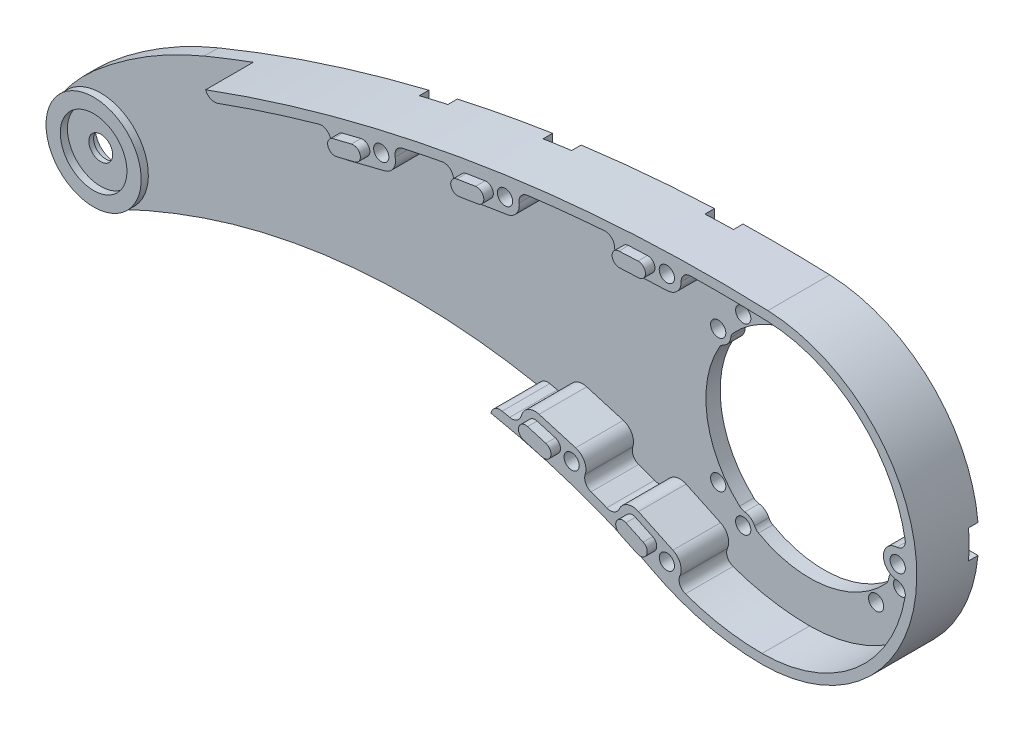
from build123d import *
from build123d.topology import SkipClean

# Parameters (mm, degrees)
SKETCH_1_R          = 1.6
EXTRUDE_1_DEPTH     = 3
EXTRUDE_START       = 10
SKETCH_2_R          = 1.6
EXTRUDE_2_DEPTH     = 10
EXTRUDE_3_DEPTH     = 2
CUT_EXTRUDE_1_REACH = 164.764
SKETCH_5_R          = 1.6
CUT_EXTRUDE_4_REACH = 164.687
SKETCH_10_R         = 2.5
SKETCH_11_R         = 4.15
CUT_EXTRUDE_5_DEPTH = 2
CUT_EXTRUDE_START   = -2
SKETCH_13_R         = 1.6
CUT_EXTRUDE_6_DEPTH = 2
EXTRUDE_START_2     = 1.5
SKETCH_14_R         = 10
SKETCH_14_R_2       = 7
EXTRUDE_4_DEPTH     = 1.5
SKETCH_15_W         = 203.491785531
SKETCH_15_H         = 102.144896266
CUT_EXTRUDE_7_DEPTH = 15


with BuildPart() as part:
    # 草图1 → 凸台-拉伸1 (new body)
    with BuildSketch(Plane.XY):
        with BuildLine():
            ThreePointArc((-23.6380873, -26.566491362), (-12.185705724, -30.993964901), (0, -32.5))
            ThreePointArc((0, -32.5), (32.494299771, -0.608672659), (1.217131806, 32.477201083))
            ThreePointArc((1.217131806, 32.477201083), (-64.206902417, 27.922113621), (-127.172269011, 9.580475598))
            ThreePointArc((-127.172269011, 9.580475598), (-139.222290641, 3.45440527), (-150.14384136, -4.511239012))
            ThreePointArc((-150.14384136, -4.511239012), (-153.910924638, -8.201852374), (-157.1671235, -12.350190882))
            ThreePointArc((-157.1671235, -12.350190882), (-156.816374649, -24.130693578), (-145.491863518, -27.395462511))
            ThreePointArc((-145.491863518, -27.395462511), (-145.026167645, -27.212412967), (-144.570211335, -27.006297405))
            ThreePointArc((-144.570211335, -27.006297405), (-136.08176084, -23.223756861), (-127.379272112, -19.963680984))
            ThreePointArc((-127.379272112, -19.963680984), (-77.471346593, -12.811545944), (-28.370763381, -24.26086005))
            ThreePointArc((-28.370763381, -24.26086005), (-25.98221149, -25.368078233), (-23.6380873, -26.566491362))
        make_face()
        with BuildLine():
            ThreePointArc((13.62552251, 16.585334135), (14.214206094, 16.415884227), (14.723986814, 16.076200182))
            ThreePointArc((14.723986814, 16.076200182), (21.531605825, 3.410271338), (18.971162667, -10.73941279))
            ThreePointArc((18.971162667, -10.73941279), (18.591300533, -11.22000242), (18.083792076, -11.563072091))
            ThreePointArc((18.083792076, -11.563072091), (17.070258581, -12.402268823), (16.585334135, -13.62552251))
            ThreePointArc((16.585334135, -13.62552251), (16.415884227, -14.214206094), (16.076200182, -14.723986814))
            ThreePointArc((16.076200182, -14.723986814), (3.410271338, -21.531605825), (-10.73941279, -18.971162667))
            ThreePointArc((-10.73941279, -18.971162667), (-11.22000242, -18.591300533), (-11.563072091, -18.083792076))
            ThreePointArc((-11.563072091, -18.083792076), (-12.402268823, -17.070258581), (-13.62552251, -16.585334135))
            ThreePointArc((-13.62552251, -16.585334135), (-14.214206094, -16.415884227), (-14.723986814, -16.076200182))
            ThreePointArc((-14.723986814, -16.076200182), (-21.531605825, -3.410271338), (-18.971162667, 10.73941279))
            ThreePointArc((-18.971162667, 10.73941279), (-18.591300533, 11.22000242), (-18.083792076, 11.563072091))
            ThreePointArc((-18.083792076, 11.563072091), (-17.070258581, 12.402268823), (-16.585334135, 13.62552251))
            ThreePointArc((-16.585334135, 13.62552251), (-16.415884227, 14.214206094), (-16.076200182, 14.723986814))
            ThreePointArc((-16.076200182, 14.723986814), (-3.410271338, 21.531605825), (10.73941279, 18.971162667))
            ThreePointArc((10.73941279, 18.971162667), (11.22000242, 18.591300533), (11.563072091, 18.083792076))
            ThreePointArc((11.563072091, 18.083792076), (12.402268823, 17.070258581), (13.62552251, 16.585334135))
        make_face(mode=Mode.SUBTRACT)
        with Locations((-13.959899742, -19.214153616)):
            Circle(SKETCH_1_R, mode=Mode.SUBTRACT)
        with Locations((13.959899742, -19.214153616)):
            Circle(SKETCH_1_R, mode=Mode.SUBTRACT)
        with Locations((-19.214153616, -13.959899742)):
            Circle(SKETCH_1_R, mode=Mode.SUBTRACT)
        with Locations((19.214153616, -13.959899742)):
            Circle(SKETCH_1_R, mode=Mode.SUBTRACT)
        with Locations((-19.214153616, 13.959899742)):
            Circle(SKETCH_1_R, mode=Mode.SUBTRACT)
        with Locations((19.214153616, 13.959899742)):
            Circle(SKETCH_1_R, mode=Mode.SUBTRACT)
        with Locations((-13.959899742, 19.214153616)):
            Circle(SKETCH_1_R, mode=Mode.SUBTRACT)
        with Locations((13.959899742, 19.214153616)):
            Circle(SKETCH_1_R, mode=Mode.SUBTRACT)
    extrude(amount=EXTRUDE_1_DEPTH)

    # 草图2 → 凸台-拉伸2 (add)
    with BuildSketch(Plane(origin=(0, 0, 0), x_dir=(-1, 0, 0), z_dir=(0, 0, -1)).offset(EXTRUDE_START)):
        with BuildLine():
            ThreePointArc((17.001102074, 28.618241459), (17.803337861, 26.493729725), (19.86429336, 25.540002931))
            Line((19.86429336, 25.540002931), (27.856104149, 25.178118556))
            ThreePointArc((27.856104149, 25.178118556), (29.994821549, 25.941676183), (30.985784325, 27.98498848))
            ThreePointArc((30.985784325, 27.98498848), (31.663067744, 29.355553639), (33.113908291, 29.837449265))
            ThreePointArc((33.113908291, 29.837449265), (41.227314196, 29.119699609), (49.318671562, 28.185646114))
            ThreePointArc((49.318671562, 28.185646114), (50.642440563, 27.420925697), (51.029255455, 25.941893607))
            ThreePointArc((51.029255455, 25.941893607), (51.587558118, 23.740659748), (53.528225459, 22.561277437))
            Line((53.528225459, 22.561277437), (61.428685658, 21.303211995))
            ThreePointArc((61.428685658, 21.303211995), (63.63968675, 21.821484643), (64.854085448, 23.740434399))
            ThreePointArc((64.854085448, 23.740434399), (65.681160173, 25.026167296), (67.176979656, 25.341897814))
            ThreePointArc((67.176979656, 25.341897814), (71.378861197, 24.513870134), (75.568707204, 23.626949189))
            ThreePointArc((75.568707204, 23.626949189), (76.820720374, 22.749666619), (77.077039123, 21.242529471))
            ThreePointArc((77.077039123, 21.242529471), (77.441191522, 19.000984157), (79.271578812, 17.656806068))
            Line((79.271578812, 17.656806068), (87.032175615, 15.714349565))
            ThreePointArc((87.032175615, 15.714349565), (89.279958958, 16.037772516), (90.657125441, 17.843470399))
            ThreePointArc((90.657125441, 17.843470399), (91.593206584, 19.052153062), (93.11086617, 19.236193992))
            ThreePointArc((93.11086617, 19.236193992), (103.776807204, 16.016684998), (114.31810295, 12.409938501))
            ThreePointArc((114.31810295, 12.409938501), (115.844352177, 12.477074745), (116.877933734, 13.602087253))
            ThreePointArc((116.877933734, 13.602087253), (58.758007498, 28.843357745), (-1.217131806, 32.477201083))
            ThreePointArc((-1.217131806, 32.477201083), (-32.494299771, -0.608672659), (0, -32.5))
            ThreePointArc((0, -32.5), (12.185705724, -30.993964901), (23.6380873, -26.566491362))
            ThreePointArc((23.6380873, -26.566491362), (25.98221149, -25.368078233), (28.370763381, -24.26086005))
            ThreePointArc((28.370763381, -24.26086005), (42.41745626, -18.97671256), (56.959270146, -15.266261857))
            ThreePointArc((56.959270146, -15.266261857), (56.095337342, -13.994443781), (54.584087249, -13.71155818))
            ThreePointArc((54.584087249, -13.71155818), (53.795279647, -13.881664917), (53.007476337, -14.056363738))
            ThreePointArc((53.007476337, -14.056363738), (51.49343256, -13.803829953), (50.585765393, -12.565992248))
            ThreePointArc((50.585765393, -12.565992248), (49.16571342, -10.693278587), (46.831558377, -10.418825857))
            Line((46.831558377, -10.418825857), (39.155257944, -12.671471339))
            ThreePointArc((39.155257944, -12.671471339), (37.339549641, -14.163720453), (37.156649606, -16.506827715))
            ThreePointArc((37.156649606, -16.506827715), (37.061812001, -18.038855032), (35.924321082, -19.069493805))
            ThreePointArc((35.924321082, -19.069493805), (34.270222566, -19.684778141), (32.624096936, -20.321085557))
            ThreePointArc((32.624096936, -20.321085557), (31.089233, -20.303922581), (30.002334443, -19.220062167))
            ThreePointArc((30.002334443, -19.220062167), (28.311680005, -17.587490076), (25.963057786, -17.674540277))
            Line((25.963057786, -17.674540277), (18.723451368, -21.078669963))
            ThreePointArc((18.723451368, -21.078669963), (17.187310183, -22.750078076), (17.261694817, -25.018954835))
            ThreePointArc((17.261694817, -25.018954835), (17.275070203, -26.622295223), (16.106540278, -27.720210117))
            ThreePointArc((16.106540278, -27.720210117), (8.172329404, -29.799953184), (0, -30.5))
            ThreePointArc((0, -30.5), (-19.662506126, -23.315999932), (-30.062360099, -5.148252645))
            ThreePointArc((-30.062360099, -5.148252645), (-29.685338806, -3.685938076), (-28.342105263, -2.995841994))
            ThreePointArc((-28.342105263, -2.995841994), (-25.5, 0), (-28.342105263, 2.995841994))
            ThreePointArc((-28.342105263, 2.995841994), (-29.685338806, 3.685938076), (-30.062360099, 5.148252645))
            ThreePointArc((-30.062360099, 5.148252645), (-20.095728615, 22.943663427), (-1.142231387, 30.478604093))
            ThreePointArc((-1.142231387, 30.478604093), (6.952265997, 30.674453283), (15.049110071, 30.655457646))
            ThreePointArc((15.049110071, 30.655457646), (16.450460044, 30.044409415), (17.001102074, 28.618241459))
        make_face()
        with Locations((20, -23.793522369)):
            Circle(SKETCH_2_R, mode=Mode.SUBTRACT)
        with Locations((-28.5, 0)):
            Circle(SKETCH_2_R, mode=Mode.SUBTRACT)
        with Locations((40, -15.550084001)):
            Circle(SKETCH_2_R, mode=Mode.SUBTRACT)
        with Locations((20, 28.536931977)):
            Circle(SKETCH_2_R, mode=Mode.SUBTRACT)
        with Locations((54, 25.523950011)):
            Circle(SKETCH_2_R, mode=Mode.SUBTRACT)
        with Locations((80, 20.567029869)):
            Circle(SKETCH_2_R, mode=Mode.SUBTRACT)
    extrude(amount=-EXTRUDE_2_DEPTH)

    # 草图4 → 凸台-拉伸3 (add)
    with BuildSketch(Plane(origin=(0, 0, -10), x_dir=(-1, 0, 0), z_dir=(0, 0, -1))):
        with BuildLine():
            Line((27.877880734, -21.746818887), (24.258077525, -23.44888373))
            ThreePointArc((24.258077525, -23.44888373), (22.262377006, -22.729731843), (22.981528893, -20.734031323))
            Line((22.981528893, -20.734031323), (26.601332102, -19.031966481))
            ThreePointArc((26.601332102, -19.031966481), (28.597032621, -19.751118368), (27.877880734, -21.746818887))
        make_face()
        with BuildLine():
            Line((27.92395747, 26.67658308), (23.928052075, 26.857525267))
            ThreePointArc((23.928052075, 26.857525267), (22.497440872, 28.42384311), (24.063758715, 29.854454313))
            Line((24.063758715, 29.854454313), (28.05966411, 29.673512126))
            ThreePointArc((28.05966411, 29.673512126), (29.490275313, 28.107194282), (27.92395747, 26.67658308))
        make_face()
        with BuildLine():
            Line((87.396386209, 17.169461466), (83.516087807, 18.140689717))
            ThreePointArc((83.516087807, 18.140689717), (82.425186501, 19.960012212), (84.244508996, 21.050913518))
            Line((84.244508996, 21.050913518), (88.124807397, 20.079685267))
            ThreePointArc((88.124807397, 20.079685267), (89.215708703, 18.260362772), (87.396386209, 17.169461466))
        make_face()
        with BuildLine():
            Line((48.098671461, -14.73674485), (44.260521244, -15.863067591))
            ThreePointArc((44.260521244, -15.863067591), (42.398843885, -14.846132288), (43.415779189, -12.984454929))
            Line((43.415779189, -12.984454929), (47.253929405, -11.858132188))
            ThreePointArc((47.253929405, -11.858132188), (49.115606764, -12.875067491), (48.098671461, -14.73674485))
        make_face()
        with BuildLine():
            Line((61.664572928, 22.784548282), (57.714342829, 23.413581003))
            ThreePointArc((57.714342829, 23.413581003), (56.468893812, 25.130804561), (58.186117369, 26.376253578))
            Line((58.186117369, 26.376253578), (62.136347469, 25.747220857))
            ThreePointArc((62.136347469, 25.747220857), (63.381796485, 24.029997299), (61.664572928, 22.784548282))
        make_face()
    extrude(amount=EXTRUDE_3_DEPTH)

    # 草图5 → 切除-拉伸1 (cut, up to next)
    with BuildSketch(Plane(origin=(0, 0, -10), x_dir=(-1, 0, 0), z_dir=(0, 0, -1)), mode=Mode.PRIVATE) as cut_extrude_1_sk1:
        with Locations((-28.5, 0)):
            Circle(SKETCH_5_R)
    cut_extrude_1_tool1 = extrude(cut_extrude_1_sk1.sketch, amount=-CUT_EXTRUDE_1_REACH, mode=Mode.PRIVATE) & part.part
    # 草图5 → 切除-拉伸1 (cut, up to next)
    with BuildSketch(Plane(origin=(0, 0, -10), x_dir=(-1, 0, 0), z_dir=(0, 0, -1)), mode=Mode.PRIVATE) as cut_extrude_1_sk2:
        with Locations((54, 25.523950011)):
            Circle(SKETCH_5_R)
    cut_extrude_1_tool2 = extrude(cut_extrude_1_sk2.sketch, amount=-CUT_EXTRUDE_1_REACH, mode=Mode.PRIVATE) & part.part
    # 草图5 → 切除-拉伸1 (cut, up to next)
    with BuildSketch(Plane(origin=(0, 0, -10), x_dir=(-1, 0, 0), z_dir=(0, 0, -1)), mode=Mode.PRIVATE) as cut_extrude_1_sk3:
        with Locations((80, 20.567029869)):
            Circle(SKETCH_5_R)
    cut_extrude_1_tool3 = extrude(cut_extrude_1_sk3.sketch, amount=-CUT_EXTRUDE_1_REACH, mode=Mode.PRIVATE) & part.part
    # 草图5 → 切除-拉伸1 (cut, up to next)
    with BuildSketch(Plane(origin=(0, 0, -10), x_dir=(-1, 0, 0), z_dir=(0, 0, -1)), mode=Mode.PRIVATE) as cut_extrude_1_sk4:
        with Locations((40, -15.550084001)):
            Circle(SKETCH_5_R)
    cut_extrude_1_tool4 = extrude(cut_extrude_1_sk4.sketch, amount=-CUT_EXTRUDE_1_REACH, mode=Mode.PRIVATE) & part.part
    # 草图5 → 切除-拉伸1 (cut, up to next)
    with BuildSketch(Plane(origin=(0, 0, -10), x_dir=(-1, 0, 0), z_dir=(0, 0, -1)), mode=Mode.PRIVATE) as cut_extrude_1_sk5:
        with Locations((20, -23.793522369)):
            Circle(SKETCH_5_R)
    cut_extrude_1_tool5 = extrude(cut_extrude_1_sk5.sketch, amount=-CUT_EXTRUDE_1_REACH, mode=Mode.PRIVATE) & part.part
    # 草图5 → 切除-拉伸1 (cut, up to next)
    with BuildSketch(Plane(origin=(0, 0, -10), x_dir=(-1, 0, 0), z_dir=(0, 0, -1)), mode=Mode.PRIVATE) as cut_extrude_1_sk6:
        with Locations((20, 28.536931977)):
            Circle(SKETCH_5_R)
    cut_extrude_1_tool6 = extrude(cut_extrude_1_sk6.sketch, amount=-CUT_EXTRUDE_1_REACH, mode=Mode.PRIVATE) & part.part
    add(cut_extrude_1_tool1.solids().sort_by_distance((28.5, 0, -10))[0], mode=Mode.SUBTRACT)
    add(cut_extrude_1_tool2.solids().sort_by_distance((-54, 25.52395, -10))[0], mode=Mode.SUBTRACT)
    add(cut_extrude_1_tool3.solids().sort_by_distance((-80, 20.56703, -10))[0], mode=Mode.SUBTRACT)
    add(cut_extrude_1_tool4.solids().sort_by_distance((-40, -15.550084, -10))[0], mode=Mode.SUBTRACT)
    add(cut_extrude_1_tool5.solids().sort_by_distance((-20, -23.793522, -10))[0], mode=Mode.SUBTRACT)
    add(cut_extrude_1_tool6.solids().sort_by_distance((-20, 28.536932, -10))[0], mode=Mode.SUBTRACT)

    # 草图10 → 切除-拉伸4 (cut, up to next)
    with BuildSketch(Plane(origin=(0, 0, 0), x_dir=(-1, 0, 0), z_dir=(0, 0, -1)), mode=Mode.PRIVATE) as cut_extrude_4_sk1:
        with Locations((148.916083752, -18)):
            Circle(SKETCH_10_R)
    cut_extrude_4_tool1 = extrude(cut_extrude_4_sk1.sketch, amount=-CUT_EXTRUDE_4_REACH, mode=Mode.PRIVATE) & part.part
    add(cut_extrude_4_tool1.solids().sort_by_distance((-148.916084, -18, 0))[0], mode=Mode.SUBTRACT)

    # 草图11 → 切除-拉伸5 (cut)
    with BuildSketch(Plane.XY.offset(3)):
        with Locations((-148.916083752, -18)):
            Circle(SKETCH_11_R)
    extrude(amount=-CUT_EXTRUDE_5_DEPTH, mode=Mode.SUBTRACT)

    # 草图13 → 切除-拉伸6 (cut)
    # profile 1 of 6: a face of its own
    with BuildSketch(Plane.XY.offset(3).offset(CUT_EXTRUDE_START)):
        with BuildLine():
            ThreePointArc((-43, -18.79486084), (-39.988341619, -19.766013748), (-37, -20.806705127))
            Line((-37, -20.806705127), (-37, -15.550084001))
            ThreePointArc((-37, -15.550084001), (-40, -12.550084001), (-43, -15.550084001))
            Line((-43, -15.550084001), (-43, -18.79486084))
        make_face()
        with Locations((-40, -15.550084001)):
            Circle(SKETCH_13_R, mode=Mode.SUBTRACT)
    # profile 2 of 6: a face of its own
    with BuildSketch(Plane.XY.offset(3).offset(CUT_EXTRUDE_START)):
        with BuildLine():
            ThreePointArc((-23, -26.902477601), (-20.04292434, -28.311736195), (-17, -29.524550153))
            Line((-17, -29.524550153), (-17, -23.793522369))
            ThreePointArc((-17, -23.793522369), (-20, -20.793522369), (-23, -23.793522369))
            Line((-23, -23.793522369), (-23, -26.902477601))
        make_face()
        with Locations((-20, -23.793522369)):
            Circle(SKETCH_13_R, mode=Mode.SUBTRACT)
    # profile 3 of 6: a face of its own
    with BuildSketch(Plane.XY.offset(3).offset(CUT_EXTRUDE_START)):
        with BuildLine():
            ThreePointArc((32.361242251, -3), (32.5, 0), (32.361242251, 3))
            Line((32.361242251, 3), (28.5, 3))
            ThreePointArc((28.5, 3), (25.5, 0), (28.5, -3))
            Line((28.5, -3), (32.361242251, -3))
        make_face()
        with Locations((28.5, 0)):
            Circle(SKETCH_13_R, mode=Mode.SUBTRACT)
    # profile 4 of 6: a face of its own
    with BuildSketch(Plane.XY.offset(3).offset(CUT_EXTRUDE_START)):
        with BuildLine():
            ThreePointArc((-17, 32.619234927), (-20.000463964, 32.53894641), (-23, 32.429338848))
            Line((-23, 32.429338848), (-23, 28.536931977))
            ThreePointArc((-23, 28.536931977), (-20, 25.536931977), (-17, 28.536931977))
            Line((-17, 28.536931977), (-17, 32.619234927))
        make_face()
        with Locations((-20, 28.536931977)):
            Circle(SKETCH_13_R, mode=Mode.SUBTRACT)
    # profile 5 of 6: a face of its own
    with BuildSketch(Plane.XY.offset(3).offset(CUT_EXTRUDE_START)):
        with BuildLine():
            ThreePointArc((-51, 29.981954991), (-54.002128749, 29.565339979), (-57, 29.119119123))
            Line((-57, 29.119119123), (-57, 25.523950011))
            ThreePointArc((-57, 25.523950011), (-54, 22.523950011), (-51, 25.523950011))
            Line((-51, 25.523950011), (-51, 29.981954991))
        make_face()
        with Locations((-54, 25.523950011)):
            Circle(SKETCH_13_R, mode=Mode.SUBTRACT)
    # profile 6 of 6: a face of its own
    with BuildSketch(Plane.XY.offset(3).offset(CUT_EXTRUDE_START)):
        with BuildLine():
            Line((-83, 23.960592486), (-83, 20.567029869))
            ThreePointArc((-83, 20.567029869), (-80, 17.567029869), (-77, 20.567029869))
            Line((-77, 20.567029869), (-77, 25.359108824))
            ThreePointArc((-77, 25.359108824), (-80.003506771, 24.674895616), (-83, 23.960592486))
        make_face()
        with Locations((-80, 20.567029869)):
            Circle(SKETCH_13_R, mode=Mode.SUBTRACT)
    extrude(amount=CUT_EXTRUDE_6_DEPTH, mode=Mode.SUBTRACT)

    # 草图14 → 凸台-拉伸4 (add)
    with BuildSketch(Plane(origin=(0, 0, 0), x_dir=(-1, 0, 0), z_dir=(0, 0, -1)).offset(EXTRUDE_START_2)):
        with Locations((148.916083752, -18)):
            Circle(SKETCH_14_R)
        with Locations((148.916083752, -18)):
            Circle(SKETCH_14_R_2, mode=Mode.SUBTRACT)
    extrude(amount=-EXTRUDE_4_DEPTH)

    # 镜向1: part across plane


with BuildPart() as part_1:
    add(part.part)
    add(part.part.mirror(Plane.XY.offset(3)))

    # 草图15 → 切除-拉伸7 (cut)
    with SkipClean():  # the faces are left unmerged after this step: merging them gives an invalid solid
        with BuildSketch(Plane(origin=(0, 0, -12), x_dir=(-1, 0, 0), z_dir=(0, 0, -1))):
            with Locations((66.100817259, 6.081379258)):
                Rectangle(SKETCH_15_W, SKETCH_15_H)
        extrude(amount=-CUT_EXTRUDE_7_DEPTH, mode=Mode.SUBTRACT)


solid = part_1.part
